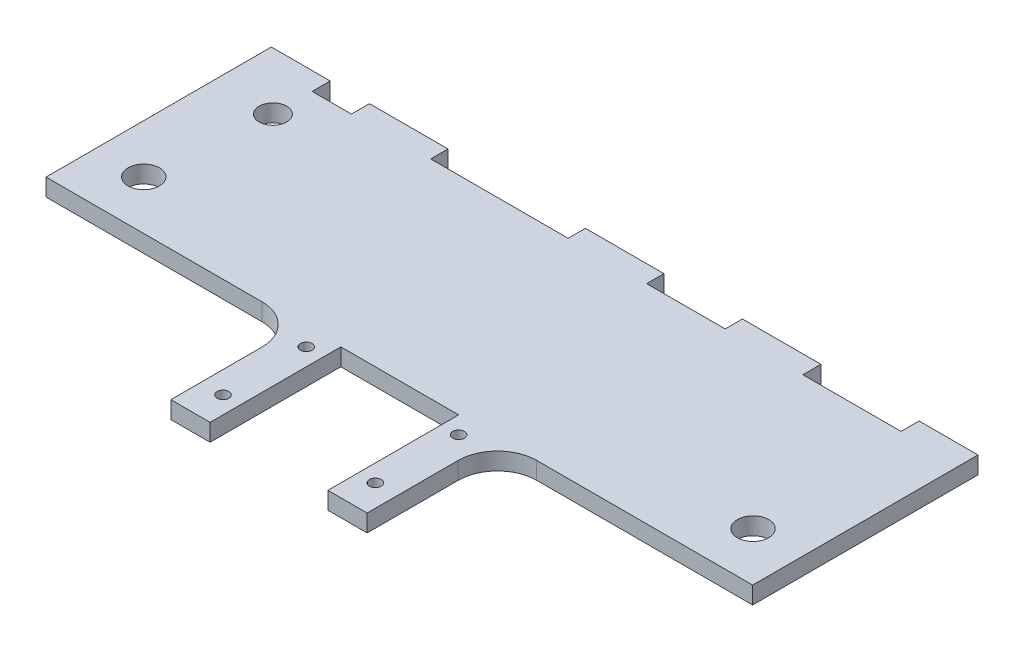
from build123d import *

# Parameters (mm, degrees)
BOSS_EXTRUDE1_DEPTH   = 5.588
F_6_CLEARANCE_HOLE1_D = 3.7973
CUT_EXTRUDE1_REACH    = 254.133
SKETCH5_R             = 5.08
CUT_EXTRUDE2_REACH    = 254.133
SKETCH6_R             = 4.445


with BuildPart() as part:
    # Sketch1 → Boss-Extrude1 (new body)
    with BuildSketch(Plane(origin=(0, 0, 0), x_dir=(1, 0, 0), z_dir=(0, 1, 0))):
        with BuildLine():
            Line((12.7, 72.898), (31.75, 72.898))
            Line((31.75, 72.898), (31.75, 67.056))
            Line((31.75, 67.056), (44.45, 67.056))
            Line((44.45, 67.056), (44.45, 72.898))
            Line((44.45, 72.898), (69.85, 72.898))
            Line((69.85, 72.898), (69.85, 67.31))
            Line((69.85, 67.31), (114.3, 67.31))
            Line((114.3, 67.31), (114.3, 72.898))
            Line((114.3, 72.898), (139.7, 72.898))
            Line((139.7, 72.898), (139.7, 67.31))
            Line((139.7, 67.31), (165.1, 67.31))
            Line((165.1, 67.31), (165.1, 72.898))
            Line((165.1, 72.898), (190.5, 72.898))
            Line((190.5, 72.898), (190.5, 67.056))
            Line((190.5, 67.056), (222.25, 67.056))
            Line((222.25, 67.056), (222.25, 72.898))
            Line((222.25, 72.898), (241.3, 72.898))
            Line((241.3, 72.898), (241.3, 0))
            Line((241.3, 0), (171.45, 0))
            ThreePointArc((171.45, 0), (162.469743879, -3.719743879), (158.75, -12.7))
            Line((158.75, -12.7), (158.75, -42.164))
            Line((158.75, -42.164), (146.05, -42.164))
            Line((146.05, -42.164), (146.05, 0.122766638))
            Line((146.05, 0.122766638), (127, 0.122766638))
            Line((127, 0.122766638), (107.95, 0.122766638))
            Line((107.95, 0.122766638), (107.95, -42.164))
            Line((107.95, -42.164), (95.25, -42.164))
            Line((95.25, -42.164), (95.25, -12.7))
            ThreePointArc((95.25, -12.7), (91.530256121, -3.719743879), (82.55, 0))
            Line((82.55, 0), (12.7, 0))
            Line((12.7, 0), (12.7, 72.898))
        make_face()
    extrude(amount=BOSS_EXTRUDE1_DEPTH)

    # #6 Clearance Hole1 (through all)
    with Locations(Plane(origin=(0, 0, 0), x_dir=(-1, 0, 0), z_dir=(0, -1, 0))):
        with Locations((-102.362, -32.397617544), (-151.638, -32.397617544), (-151.638, -5.456849181), (-102.362, -5.456849181)):
            Hole(F_6_CLEARANCE_HOLE1_D / 2)

    # Sketch5 → Cut-Extrude1 (cut, up to next)
    with BuildSketch(Plane(origin=(0, 5.588, 0), x_dir=(1, 0, 0), z_dir=(0, 1, 0)), mode=Mode.PRIVATE) as cut_extrude1_sk1:
        with Locations((225.552, 15.870766638)):
            Circle(SKETCH5_R)
    cut_extrude1_tool1 = extrude(cut_extrude1_sk1.sketch, amount=-CUT_EXTRUDE1_REACH, mode=Mode.PRIVATE) & part.part
    # Sketch5 → Cut-Extrude1 (cut, up to next)
    with BuildSketch(Plane(origin=(0, 5.588, 0), x_dir=(1, 0, 0), z_dir=(0, 1, 0)), mode=Mode.PRIVATE) as cut_extrude1_sk2:
        with Locations((28.448, 15.870766638)):
            Circle(SKETCH5_R)
    cut_extrude1_tool2 = extrude(cut_extrude1_sk2.sketch, amount=-CUT_EXTRUDE1_REACH, mode=Mode.PRIVATE) & part.part
    add(cut_extrude1_tool1.solids().sort_by_distance((225.552, 5.588, -15.870767))[0], mode=Mode.SUBTRACT)
    add(cut_extrude1_tool2.solids().sort_by_distance((28.448, 5.588, -15.870767))[0], mode=Mode.SUBTRACT)

    # Sketch6 → Cut-Extrude2 (cut, up to next)
    with BuildSketch(Plane.XZ, mode=Mode.PRIVATE) as cut_extrude2_sk1:
        with Locations((31.75, -54.356)):
            Circle(SKETCH6_R)
    cut_extrude2_tool1 = extrude(cut_extrude2_sk1.sketch, amount=-CUT_EXTRUDE2_REACH, mode=Mode.PRIVATE) & part.part
    add(cut_extrude2_tool1.solids().sort_by_distance((31.75, 0, -54.356))[0], mode=Mode.SUBTRACT)


solid = part.part
